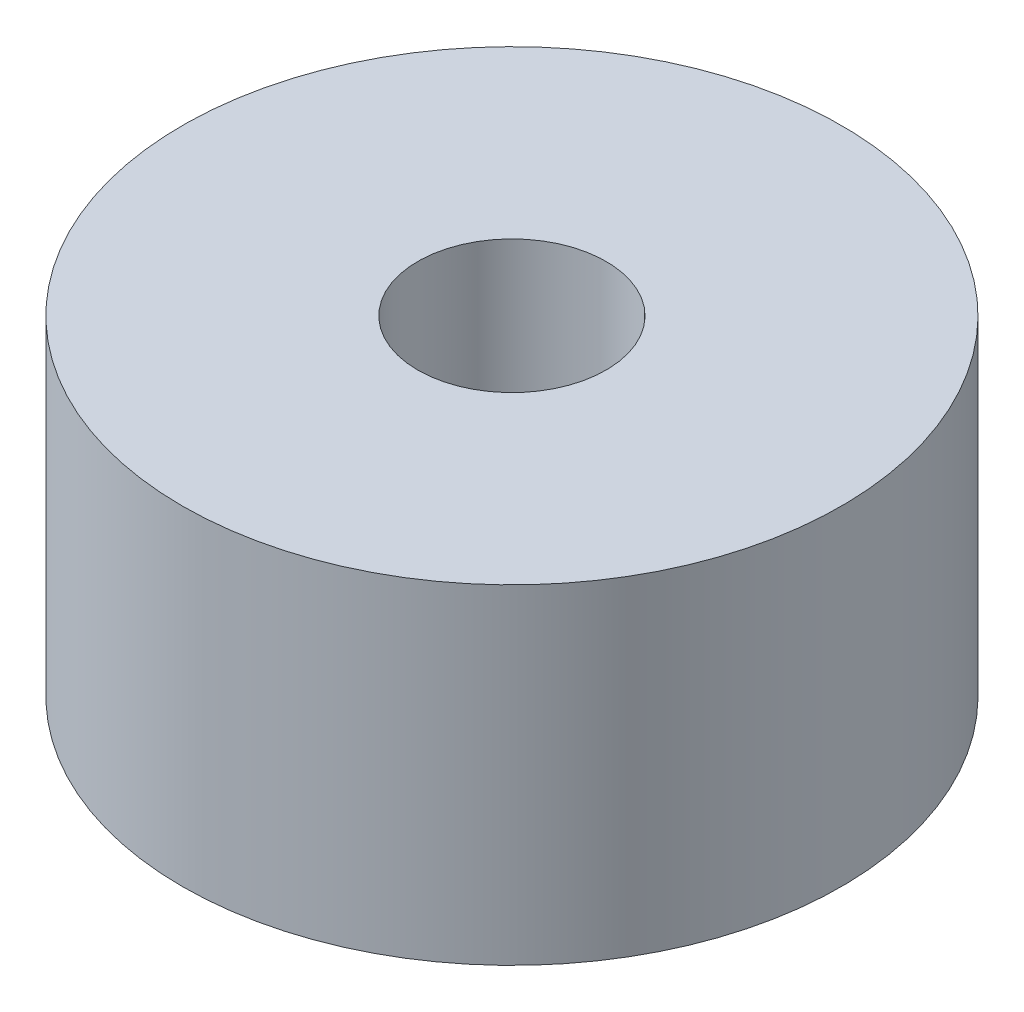
from build123d import *

# Parameters (mm, degrees)
SKETCH1_R           = 35
SKETCH1_R_2         = 10
BOSS_EXTRUDE1_DEPTH = 35


with BuildPart() as part:
    # Sketch1 → Boss-Extrude1 (new body)
    with BuildSketch(Plane(origin=(0, 0, 0), x_dir=(1, 0, 0), z_dir=(0, 1, 0))):
        Circle(SKETCH1_R)
        Circle(SKETCH1_R_2, mode=Mode.SUBTRACT)
    extrude(amount=BOSS_EXTRUDE1_DEPTH)


solid = part.part
